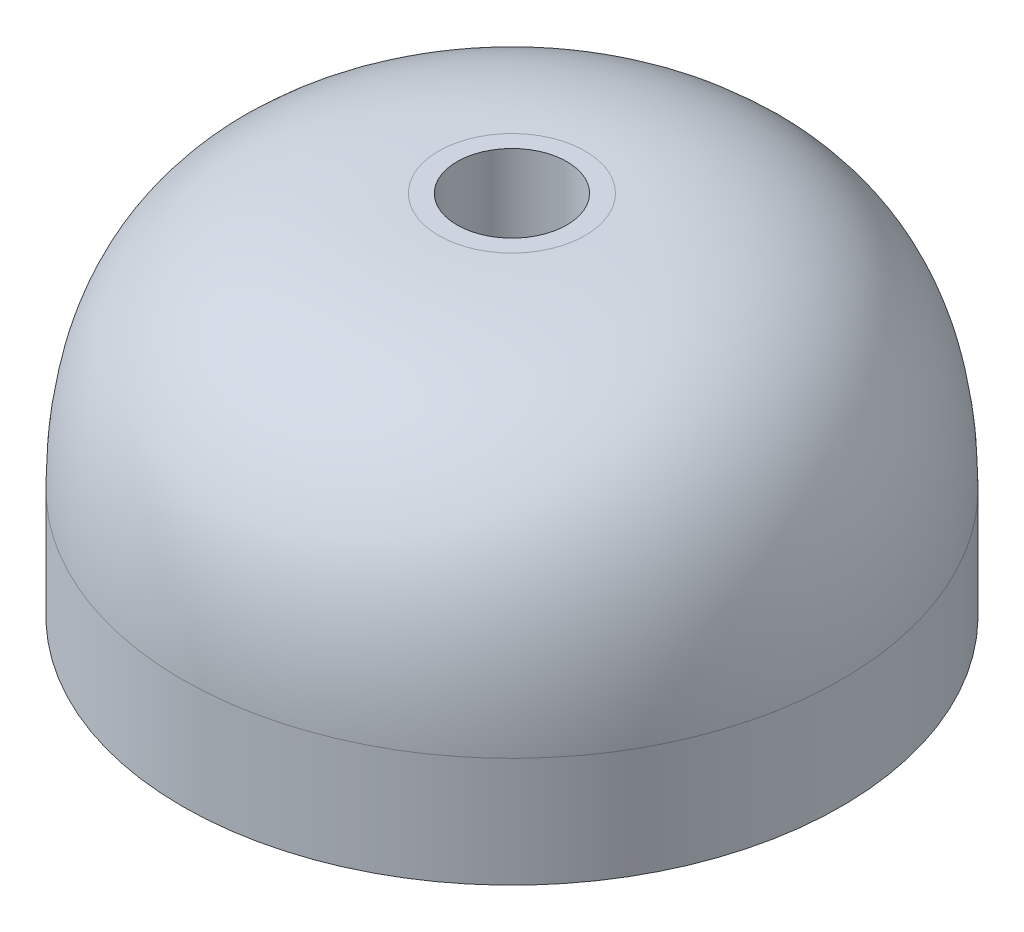
from build123d import *

# Parameters (mm, degrees)
SZKIC1_R                    = 9
DODANIE_WYCI_GNI_CIE1_DEPTH = 10
ZAOKR_GLENIE1_SIZE          = 7
WYTNIJ_WYCI_GNI_CIE1_REACH  = 18.186
SZKIC2_R                    = 1.5


with BuildPart() as part:
    # Szkic1 → Dodanie-wyciągnięcie1 (new body)
    with BuildSketch(Plane(origin=(0, 0, 0), x_dir=(1, 0, 0), z_dir=(0, 1, 0))):
        with Locations(Location((0, 0, 0), (0, 0, 270))):
            Circle(SZKIC1_R)
    extrude(amount=DODANIE_WYCI_GNI_CIE1_DEPTH)

    # Zaokrąglenie1
    # a fillet whose section is not a circle: 7 mm, written as the material it takes off along each edge
    with BuildSketch(Plane(origin=(0, 10, 0), x_dir=(0, 0, 1), z_dir=(-1, 0, 0))) as zaokr_glenie1_piece_1:
        with BuildLine():
            Bezier((9, -ZAOKR_GLENIE1_SIZE), (9, 0), (9 - ZAOKR_GLENIE1_SIZE, 0), weights=[1, 1, 1])
            Line((9 - ZAOKR_GLENIE1_SIZE, 0), (9, 0))
            Line((9, 0), (9, -ZAOKR_GLENIE1_SIZE))
        make_face()
    revolve(axis=Axis((0, 10, 0), (0, 1, 0)), mode=Mode.SUBTRACT)

    # Szkic2 → Wytnij-wyciągnięcie1 (cut, up to next)
    with BuildSketch(Plane(origin=(0, 0, 0), x_dir=(1, 0, 0), z_dir=(0, 1, 0)), mode=Mode.PRIVATE) as wytnij_wyci_gni_cie1_sk1:
        with Locations(Location((0, 0, 0), (0, 0, 270))):
            Circle(SZKIC2_R)
    wytnij_wyci_gni_cie1_tool1 = extrude(wytnij_wyci_gni_cie1_sk1.sketch, amount=WYTNIJ_WYCI_GNI_CIE1_REACH, mode=Mode.PRIVATE) & part.part
    add(wytnij_wyci_gni_cie1_tool1.solids().sort_by_distance((0, 0, 0))[0], mode=Mode.SUBTRACT)


solid = part.part
